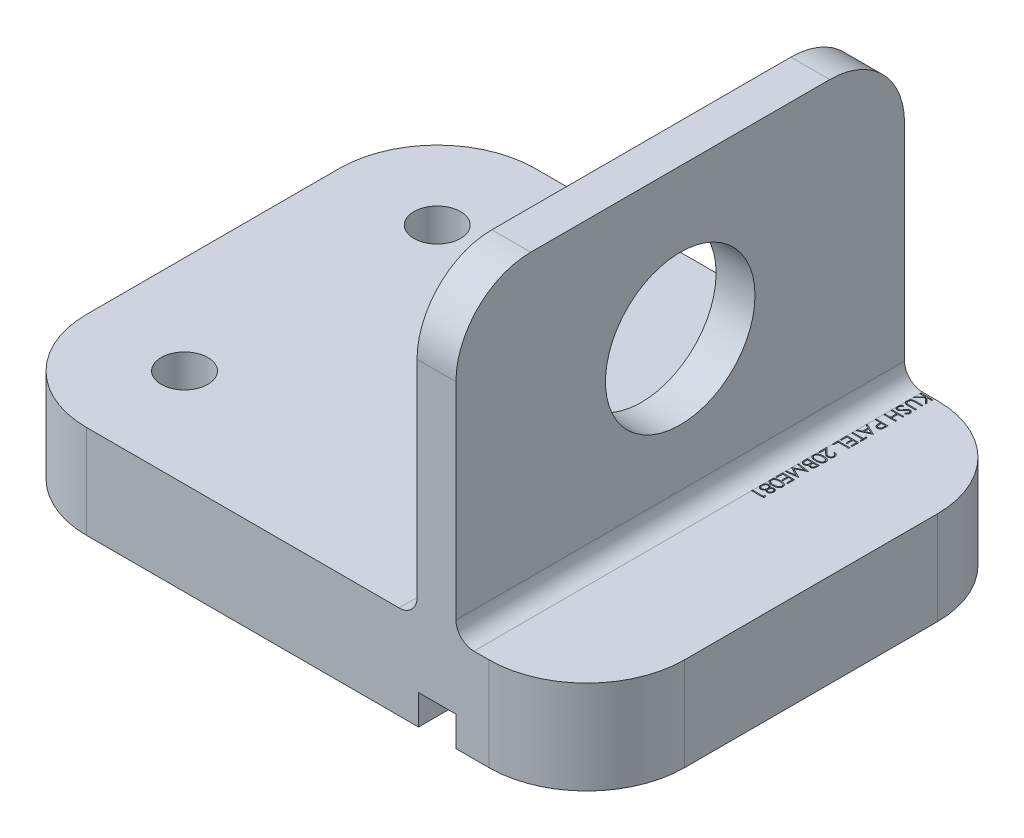
from build123d import *

# Parameters (mm, degrees)
SKETCH1_W             = 2865
SKETCH1_H             = 3000
SKETCH1_R             = 156
BOSS_EXTRUDE2_DEPTH   = 625
SKETCH1_W_2           = 875
BOSS_EXTRUDE2_2_DEPTH = 625
SKETCH1_4_W           = 260
SKETCH1_4_H           = 3000
BOSS_EXTRUDE3_DEPTH   = 2625
SKETCH2_R             = 500
CUT_EXTRUDE1_DEPTH    = 1000
SKETCH3_W             = 250
SKETCH3_H             = 3000
CUT_EXTRUDE2_DEPTH    = 200
FILLET2_R             = 655
FILLET3_R             = 655
FILLET4_R             = 655
FILLET5_R             = 655
FILLET11_R            = 120
FILLET13_R            = 120
FILLET14_R            = 500
FILLET15_R            = 500
CUT_EXTRUDE4_DEPTH    = 30


with BuildPart() as part:
    # Sketch1 → Boss-Extrude2 (new body)
    with BuildSketch(Plane(origin=(0, 0, 0), x_dir=(1, 0, 0), z_dir=(0, 1, 0))):
        with Locations((1432.5, 1500)):
            Rectangle(SKETCH1_W, SKETCH1_H)
        with Locations((655, 655)):
            Circle(SKETCH1_R, mode=Mode.SUBTRACT)
        with Locations((655, 2345)):
            Circle(SKETCH1_R, mode=Mode.SUBTRACT)
    extrude(amount=BOSS_EXTRUDE2_DEPTH)



with BuildPart() as body_2:
    # Sketch1 → Boss-Extrude2 2 (new body)
    with BuildSketch(Plane(origin=(0, 0, 0), x_dir=(1, 0, 0), z_dir=(0, 1, 0))):
        with Locations((3562.5, 1500)):
            Rectangle(SKETCH1_W_2, SKETCH1_H)
    extrude(amount=BOSS_EXTRUDE2_2_DEPTH)


with BuildPart() as part_1:
    add(part.part)

    add(body_2.part)  # Boss-Extrude3 merges body 2
    # Sketch1<4> → Boss-Extrude3 (add)
    with BuildSketch(Plane(origin=(0, 0, 0), x_dir=(1, 0, 0), z_dir=(0, 1, 0))):
        with Locations((2995, 1500)):
            Rectangle(SKETCH1_4_W, SKETCH1_4_H)
    extrude(amount=BOSS_EXTRUDE3_DEPTH)

    # Sketch2 → Cut-Extrude1 (cut)
    with BuildSketch(Plane(origin=(3125, 0, 0), x_dir=(0, 0, -1), z_dir=(1, 0, 0))):
        with Locations((1500, 1625)):
            Circle(SKETCH2_R)
    extrude(amount=-CUT_EXTRUDE1_DEPTH, mode=Mode.SUBTRACT)

    # Sketch3 → Cut-Extrude2 (cut)
    with BuildSketch(Plane.XZ):
        with Locations((3000, -1500)):
            Rectangle(SKETCH3_W, SKETCH3_H)
    extrude(amount=-CUT_EXTRUDE2_DEPTH, mode=Mode.SUBTRACT)

    # Fillet2
    fillet2_edges = [part_1.edges().sort_by_distance(p)[0] for p in [
        (0, 312.5, 0),
    ]]
    fillet(fillet2_edges, radius=FILLET2_R)

    # Fillet3
    fillet3_edges = [part_1.edges().sort_by_distance(p)[0] for p in [
        (0, 312.5, -3000),
    ]]
    fillet(fillet3_edges, radius=FILLET3_R)

    # Fillet4
    fillet4_edges = [part_1.edges().sort_by_distance(p)[0] for p in [
        (4000, 312.5, 0),
    ]]
    fillet(fillet4_edges, radius=FILLET4_R)

    # Fillet5
    fillet5_edges = [part_1.edges().sort_by_distance(p)[0] for p in [
        (4000, 312.5, -3000),
    ]]
    fillet(fillet5_edges, radius=FILLET5_R)

    # Fillet11
    fillet11_edges = [part_1.edges().sort_by_distance(p)[0] for p in [
        (2865, 625, -1500),
    ]]
    fillet(fillet11_edges, radius=FILLET11_R)

    # Fillet13
    fillet13_edges = [part_1.edges().sort_by_distance(p)[0] for p in [
        (3125, 625, -1500),
    ]]
    fillet(fillet13_edges, radius=FILLET13_R)

    # Fillet14
    fillet14_edges = [part_1.edges().sort_by_distance(p)[0] for p in [
        (2995, 2625, 0),
    ]]
    fillet(fillet14_edges, radius=FILLET14_R)

    # Fillet15
    fillet15_edges = [part_1.edges().sort_by_distance(p)[0] for p in [
        (2995, 2625, -3000),
    ]]
    fillet(fillet15_edges, radius=FILLET15_R)

    # Sketch6 → Cut-Extrude4 (cut)
    # profile 1 of 17: a face of its own
    with BuildSketch(Plane(origin=(0, 625, 0), x_dir=(1, 0, 0), z_dir=(0, 1, 0))):
        Polygon((3325, 2989.743589744), (3325, 2982.564102564), (3294.53525641, 2982.564102564), (3325, 2949.21474359), (3325, 2938.974358974), (3289.102564103, 2978.28525641), (3245, 2935.897435897), (3245, 2945.46474359), (3283.605769231, 2982.564102564), (3245, 2982.564102564), (3245, 2989.743589744), align=None)
    # profile 2 of 17: a face of its own
    with BuildSketch(Plane(origin=(0, 625, 0), x_dir=(1, 0, 0), z_dir=(0, 1, 0))):
        with BuildLine():
            Line((3325, 2924.102564103), (3325, 2916.923076923))
            Line((3325, 2916.923076923), (3277.067307692, 2916.923076923))
            add(Edge.make_bspline(
                [(3277.067307692, 2916.923076923), (3276.388890875, 2916.924145357), (3275.101478054, 2916.926172894), (3273.269059756, 2916.91262972), (3271.639974977, 2916.874701299), (3270.207944176, 2916.85078908), (3268.97953852, 2916.797592885), (3267.948102847, 2916.754208956), (3267.118521077, 2916.698424803), (3266.634385624, 2916.631382117), (3266.426282051, 2916.602564103)],
                knots=[0, 0, 0, 0, 1.528628734, 2.90083645, 4.128790002, 5.200304208, 6.127813768, 6.898992206, 7.526736466, 8, 8, 8, 8], degree=3))
            add(Edge.make_bspline(
                [(3266.426282051, 2916.602564103), (3265.675433864, 2916.484337058), (3264.216045098, 2916.25454464), (3262.139031094, 2915.66677021), (3260.260720003, 2914.852502388), (3258.543651238, 2913.861085985), (3257.013352204, 2912.586100863), (3255.592614054, 2911.068615057), (3254.365196827, 2909.212926434), (3253.235979056, 2907.150858915), (3252.329682801, 2904.926908733), (3251.644033478, 2902.654725838), (3251.226252101, 2900.368010199), (3251.177871178, 2898.837128912), (3251.153846154, 2898.076923077)],
                knots=[0, 0, 0, 0, 1.035924841, 2.013479024, 2.933602255, 3.82183108, 4.706948133, 5.639927629, 6.646101806, 7.731477349, 8.84205456, 9.913728764, 10.963998332, 12, 12, 12, 12], degree=3))
            add(Edge.make_bspline(
                [(3251.153846154, 2898.076923077), (3251.178389947, 2897.42426497), (3251.227335774, 2896.122718337), (3251.530474401, 2894.188874696), (3252.076695914, 2892.305376328), (3252.781897361, 2890.463330502), (3253.712186697, 2888.735504682), (3254.794267001, 2887.123135394), (3256.044994929, 2885.668703517), (3257.448883154, 2884.357078009), (3259.018429196, 2883.208688394), (3260.748904045, 2882.239744581), (3262.634619106, 2881.42311066), (3263.964319406, 2881.022907129), (3264.647435897, 2880.817307692)],
                knots=[0, 0, 0, 0, 0.994510594, 1.983277156, 2.972612928, 3.9776239, 4.982470102, 5.955333794, 6.930747147, 7.898149105, 8.876444039, 9.885893618, 10.913904934, 12, 12, 12, 12], degree=3))
            add(Edge.make_bspline(
                [(3264.647435897, 2880.817307692), (3264.929689025, 2880.7487334), (3265.558662741, 2880.595922241), (3266.622006526, 2880.453132641), (3267.876620559, 2880.30441206), (3269.331519138, 2880.201221889), (3270.981827083, 2880.100622565), (3272.83614154, 2880.040438044), (3274.887729215, 2880.012620149), (3276.31943577, 2880.004330312), (3277.067307692, 2880)],
                knots=[0, 0, 0, 0, 0.558680831, 1.244966039, 2.062412453, 2.990489873, 4.051219941, 5.244515665, 6.560634259, 8, 8, 8, 8], degree=3))
            Line((3277.067307692, 2880), (3325, 2880))
            Line((3325, 2880), (3325, 2872.820512821))
            Line((3325, 2872.820512821), (3276.682692308, 2872.820512821))
            add(Edge.make_bspline(
                [(3276.682692308, 2872.820512821), (3275.811862848, 2872.826257117), (3274.112386211, 2872.837467459), (3271.622199593, 2872.93665779), (3269.259385913, 2873.090240001), (3267.026959981, 2873.322422988), (3264.922263304, 2873.578744652), (3262.948370821, 2873.945489078), (3261.092047109, 2874.328879366), (3259.356470445, 2874.813823989), (3257.71867739, 2875.398827123), (3256.135469774, 2876.083754921), (3254.619789738, 2876.921861394), (3253.149746876, 2877.87825547), (3251.723327271, 2878.940114142), (3250.374029044, 2880.164035945), (3249.057615454, 2881.486654564), (3247.817526002, 2882.935830479), (3246.672171876, 2884.485665285), (3245.686938248, 2886.138912001), (3244.821846699, 2887.862280772), (3244.138507975, 2889.674230331), (3243.6096009, 2891.562958635), (3243.220362467, 2893.528368073), (3242.99830599, 2895.577142295), (3242.965387426, 2896.970636877), (3242.948717949, 2897.676282051)],
                knots=[0, 0, 0, 0, 1.316364231, 2.568964831, 3.766826305, 4.894964518, 5.961692026, 6.970710131, 7.928946231, 8.826316495, 9.692177228, 10.556379512, 11.43093279, 12.306715499, 13.20629939, 14.115652445, 15.057829886, 16.025681089, 16.996391533, 17.967202739, 18.931442607, 19.907779629, 20.889445314, 21.893507297, 22.933303057, 24, 24, 24, 24], degree=3))
            add(Edge.make_bspline(
                [(3242.948717949, 2897.676282051), (3242.96665544, 2898.445861539), (3243.001848735, 2899.955773742), (3243.203511595, 2902.180643852), (3243.583360608, 2904.313539767), (3244.067016465, 2906.376988385), (3244.734073317, 2908.342896891), (3245.513459028, 2910.237604191), (3246.470653549, 2912.028659759), (3247.535645389, 2913.745119842), (3248.733922833, 2915.341114268), (3250.039983952, 2916.806197768), (3251.432906864, 2918.142789096), (3252.927772367, 2919.328359298), (3254.512954241, 2920.382550946), (3256.192936865, 2921.290670109), (3257.967069806, 2922.070401403), (3259.200285815, 2922.472837222), (3259.823717949, 2922.676282051)],
                knots=[0, 0, 0, 0, 1.13879206, 2.234305948, 3.301075583, 4.341971843, 5.366689343, 6.369221514, 7.369726634, 8.367512178, 9.355451585, 10.318319045, 11.268648973, 12.207971039, 13.137398894, 14.081662264, 15.030215811, 16, 16, 16, 16], degree=3))
            add(Edge.make_bspline(
                [(3259.823717949, 2922.676282051), (3260.249605365, 2922.794617095), (3261.173364655, 2923.051288441), (3262.702198679, 2923.326152387), (3264.462539654, 2923.55721711), (3266.454508073, 2923.774487013), (3268.679647882, 2923.902691766), (3271.13699453, 2924.015090365), (3273.829519368, 2924.103355937), (3275.705051154, 2924.102835425), (3276.682692308, 2924.102564103)],
                knots=[0, 0, 0, 0, 0.625038921, 1.35572334, 2.194682327, 3.136881307, 4.189498639, 5.346923369, 6.617055217, 8, 8, 8, 8], degree=3))
            Line((3276.682692308, 2924.102564103), (3325, 2924.102564103))
        make_face()
    # profile 3 of 17: a face of its own
    with BuildSketch(Plane(origin=(0, 625, 0), x_dir=(1, 0, 0), z_dir=(0, 1, 0))):
        with BuildLine():
            Line((3260.432692308, 2859.487179487), (3264.487179487, 2852.724358974))
            add(Edge.make_bspline(
                [(3264.487179487, 2852.724358974), (3263.43427926, 2852.095370694), (3261.416963056, 2850.890253423), (3258.691064989, 2848.879936642), (3256.374215692, 2846.796898673), (3254.479893234, 2844.625713906), (3252.988490108, 2842.379635092), (3251.932439097, 2840.043999578), (3251.273788232, 2837.62667819), (3251.193786253, 2835.98156227), (3251.153846154, 2835.16025641)],
                knots=[0, 0, 0, 0, 1.272034388, 2.437168799, 3.508375237, 4.49857839, 5.41946034, 6.295179144, 7.148887113, 8, 8, 8, 8], degree=3))
            add(Edge.make_bspline(
                [(3251.153846154, 2835.16025641), (3251.173381501, 2834.458842383), (3251.212110373, 2833.068287427), (3251.584243349, 2831.021151505), (3252.1559478, 2829.032992023), (3252.974717012, 2827.144809569), (3253.965292683, 2825.382569985), (3255.161841015, 2823.837464252), (3256.501183347, 2822.500878294), (3257.996473536, 2821.41055269), (3259.599054404, 2820.564125855), (3261.258742646, 2819.95162798), (3262.968237831, 2819.561809921), (3264.127223966, 2819.512193902), (3264.711538462, 2819.487179487)],
                knots=[0, 0, 0, 0, 1.095270387, 2.171376115, 3.241375676, 4.322296363, 5.380636668, 6.392615365, 7.366724986, 8.328592944, 9.273498763, 10.190095884, 11.087518669, 12, 12, 12, 12], degree=3))
            add(Edge.make_bspline(
                [(3264.711538462, 2819.487179487), (3265.377615026, 2819.520878017), (3266.73165135, 2819.589382205), (3268.729357703, 2820.168387464), (3270.706330732, 2821.079227392), (3271.929216802, 2821.919516391), (3272.564102564, 2822.355769231)],
                knots=[0, 0, 0, 0, 0.938893495, 1.908633276, 2.914225137, 4, 4, 4, 4], degree=3))
            add(Edge.make_bspline(
                [(3272.564102564, 2822.355769231), (3273.023252373, 2822.712940684), (3273.990009449, 2823.464978521), (3275.404991625, 2824.775759953), (3276.900210881, 2826.273856447), (3278.469595473, 2827.966757388), (3280.084484534, 2829.888114129), (3281.778540586, 2831.99847395), (3283.54667235, 2834.308761307), (3284.715920625, 2835.936947435), (3285.320512821, 2836.778846154)],
                knots=[0, 0, 0, 0, 0.72226686, 1.520759855, 2.393439377, 3.351307446, 4.386958158, 5.510256019, 6.712608938, 8, 8, 8, 8], degree=3))
            add(Edge.make_bspline(
                [(3285.320512821, 2836.778846154), (3285.920160615, 2837.620425222), (3287.066641535, 2839.229460316), (3288.76599404, 2841.481393664), (3290.329586105, 2843.492417892), (3291.735637468, 2845.272780165), (3293.045472968, 2846.776420257), (3294.18889274, 2848.058307048), (3295.226954099, 2849.071146884), (3295.899821983, 2849.634768362), (3296.201923077, 2849.887820513)],
                knots=[0, 0, 0, 0, 1.452255772, 2.776602448, 3.96446981, 5.032613149, 5.964194703, 6.766668629, 7.446264616, 8, 8, 8, 8], degree=3))
            add(Edge.make_bspline(
                [(3296.201923077, 2849.887820513), (3296.672803919, 2850.24147869), (3297.598854291, 2850.936994957), (3299.046279612, 2851.855075082), (3300.52795425, 2852.635398803), (3302.047859725, 2853.247109252), (3303.5846581, 2853.762222826), (3305.158400859, 2854.108689813), (3306.762026423, 2854.325636029), (3307.841192152, 2854.347852864), (3308.381410256, 2854.358974359)],
                knots=[0, 0, 0, 0, 1.068054152, 2.10047183, 3.106115577, 4.101338837, 5.06977816, 6.043150881, 7.020423561, 8, 8, 8, 8], degree=3))
            add(Edge.make_bspline(
                [(3308.381410256, 2854.358974359), (3309.227875971, 2854.329271147), (3310.90271479, 2854.270499608), (3313.348105587, 2853.769399691), (3315.689925636, 2852.987716934), (3317.876591783, 2851.857174807), (3319.902990485, 2850.459406128), (3321.738161682, 2848.807463115), (3323.294068645, 2846.846144399), (3324.637729575, 2844.682199636), (3325.698606066, 2842.328880846), (3326.503122538, 2839.867304092), (3326.952896512, 2837.286675267), (3327.018164638, 2835.535826433), (3327.051282051, 2834.647435897)],
                knots=[0, 0, 0, 0, 1.005541892, 1.989591032, 2.955705311, 3.932863626, 4.905387107, 5.876519979, 6.856563935, 7.871847665, 8.897921447, 9.918317993, 10.943742853, 12, 12, 12, 12], degree=3))
            add(Edge.make_bspline(
                [(3327.051282051, 2834.647435897), (3327.019375685, 2833.70457308), (3326.956101547, 2831.834763368), (3326.386249751, 2829.07919658), (3325.465758682, 2826.421053235), (3324.405576235, 2824.28137809), (3323.351452994, 2822.609672349), (3322.390931411, 2821.334889124), (3321.285234977, 2820.043055115), (3320.031303345, 2818.723787229), (3318.617665092, 2817.399428727), (3317.053991683, 2816.050321415), (3315.349841985, 2814.673309508), (3314.133281946, 2813.787461283), (3313.509615385, 2813.333333333)],
                knots=[0, 0, 0, 0, 1.286821612, 2.551921131, 3.825787379, 5.12137259, 5.803616487, 6.523126609, 7.299589446, 8.125436757, 9.008162487, 9.944516264, 10.946261234, 12, 12, 12, 12], degree=3))
            Line((3313.509615385, 2813.333333333), (3308.58974359, 2819.823717949))
            add(Edge.make_bspline(
                [(3308.58974359, 2819.823717949), (3309.094627956, 2820.215624972), (3310.0669172, 2820.970346268), (3311.428547084, 2822.11616317), (3312.672352963, 2823.196132064), (3313.752696656, 2824.260141868), (3314.728752248, 2825.251994126), (3315.56438139, 2826.214676524), (3316.26789645, 2827.134295632), (3317.018302195, 2828.293636164), (3317.766887453, 2829.753877583), (3318.386843851, 2831.585094788), (3318.772809904, 2833.493553871), (3318.821437119, 2834.789832495), (3318.846153846, 2835.448717949)],
                knots=[0, 0, 0, 0, 1.181667846, 2.275615987, 3.290305621, 4.226321945, 5.078535498, 5.862783384, 6.581873284, 7.217493746, 8.414623899, 9.604724551, 10.782505457, 12, 12, 12, 12], degree=3))
            add(Edge.make_bspline(
                [(3318.846153846, 2835.448717949), (3318.818457847, 2836.275152747), (3318.765048722, 2837.868854402), (3318.181734773, 2840.13148837), (3317.263292252, 2842.167920943), (3315.976092752, 2843.917693858), (3314.451041491, 2845.374539048), (3312.696096232, 2846.428378105), (3310.758212744, 2847.062667581), (3309.406403456, 2847.140068259), (3308.717948718, 2847.179487179)],
                knots=[0, 0, 0, 0, 1.14458467, 2.207223713, 3.21896685, 4.227309161, 5.202851033, 6.127160689, 7.046193047, 8, 8, 8, 8], degree=3))
            add(Edge.make_bspline(
                [(3308.717948718, 2847.179487179), (3308.289452769, 2847.170083109), (3307.431760195, 2847.15125959), (3306.161254189, 2846.906439625), (3304.902026024, 2846.559292274), (3303.64847643, 2846.051220746), (3302.371114691, 2845.366871215), (3301.073389531, 2844.436361579), (3299.72253651, 2843.272255718), (3298.84481878, 2842.378779704), (3298.381410256, 2841.907051282)],
                knots=[0, 0, 0, 0, 0.858526328, 1.718456515, 2.587092892, 3.476767204, 4.426280253, 5.487868114, 6.673670035, 8, 8, 8, 8], degree=3))
            add(Edge.make_bspline(
                [(3298.381410256, 2841.907051282), (3298.225135381, 2841.731934198), (3297.853862047, 2841.315896092), (3297.24603849, 2840.555303504), (3296.496260837, 2839.550896687), (3295.568550746, 2838.328903518), (3294.492403041, 2836.866792392), (3293.28157762, 2835.164402538), (3291.896767128, 2833.240710359), (3290.928594772, 2831.875637995), (3290.416666667, 2831.153846154)],
                knots=[0, 0, 0, 0, 0.420754252, 0.999615792, 1.744751191, 2.668019286, 3.750313428, 4.999500688, 6.413464383, 8, 8, 8, 8], degree=3))
            add(Edge.make_bspline(
                [(3290.416666667, 2831.153846154), (3289.784864163, 2830.285596707), (3288.56146618, 2828.60435199), (3286.723393493, 2826.212178734), (3284.925730212, 2824.043177407), (3283.179956335, 2822.089732754), (3281.499314209, 2820.332546275), (3279.863584373, 2818.79111266), (3278.284485569, 2817.44972568), (3276.259969553, 2816.005629258), (3273.77354477, 2814.530021955), (3270.727185032, 2813.262787499), (3267.66898342, 2812.463739558), (3265.613512872, 2812.359247776), (3264.599358974, 2812.307692308)],
                knots=[0, 0, 0, 0, 1.163667725, 2.253281268, 3.268753668, 4.215851969, 5.092017293, 5.902905408, 6.650798638, 7.335211899, 8.59617414, 9.77448103, 10.901945474, 12, 12, 12, 12], degree=3))
            add(Edge.make_bspline(
                [(3264.599358974, 2812.307692308), (3263.882144855, 2812.322720952), (3262.46164443, 2812.352486395), (3260.375731879, 2812.694328801), (3258.350189219, 2813.195800982), (3256.408218591, 2813.94924775), (3254.523834825, 2814.876058451), (3252.714395751, 2816.020802693), (3251.004775509, 2817.400791141), (3249.359397071, 2818.934592409), (3247.873147305, 2820.639155404), (3246.543863347, 2822.436453962), (3245.431261025, 2824.338156333), (3244.535613285, 2826.335058067), (3243.824016522, 2828.416112713), (3243.312535637, 2830.583510347), (3242.997898744, 2832.843286521), (3242.965294562, 2834.379311066), (3242.948717949, 2835.16025641)],
                knots=[0, 0, 0, 0, 0.983610584, 1.948120116, 2.894308362, 3.843560551, 4.801159957, 5.773581695, 6.77566113, 7.813174769, 8.857584665, 9.875476876, 10.877851407, 11.875574773, 12.875048225, 13.892438445, 14.928473903, 16, 16, 16, 16], degree=3))
            add(Edge.make_bspline(
                [(3242.948717949, 2835.16025641), (3242.96053598, 2835.764466154), (3242.984023207, 2836.965276243), (3243.186746214, 2838.736652185), (3243.484041969, 2840.475500287), (3243.937310312, 2842.159987222), (3244.500197606, 2843.811087909), (3245.189371657, 2845.414084941), (3246.00979833, 2846.97287288), (3246.962836522, 2848.489271958), (3248.061179459, 2849.977571015), (3249.330474728, 2851.430139969), (3250.761955052, 2852.863596338), (3252.370300604, 2854.251662655), (3254.138327848, 2855.619924606), (3256.080851122, 2856.942936895), (3258.187786669, 2858.247639942), (3259.670413721, 2859.066282307), (3260.432692308, 2859.487179487)],
                knots=[0, 0, 0, 0, 0.915384692, 1.819241058, 2.699029451, 3.586605375, 4.459625921, 5.340865773, 6.228072412, 7.126546901, 8.052715223, 9.028303326, 10.047266019, 11.120332924, 12.245748783, 13.433636234, 14.680528497, 16, 16, 16, 16], degree=3))
        make_face()
    # profile 4 of 17: a face of its own
    with BuildSketch(Plane(origin=(0, 625, 0), x_dir=(1, 0, 0), z_dir=(0, 1, 0))):
        Polygon((3325, 2795.897435897), (3325, 2788.717948718), (3292.179487179, 2788.717948718), (3292.179487179, 2747.692307692), (3325, 2747.692307692), (3325, 2740.512820513), (3245, 2740.512820513), (3245, 2747.692307692), (3283.974358974, 2747.692307692), (3283.974358974, 2788.717948718), (3245, 2788.717948718), (3245, 2795.897435897), align=None)
    # profile 5 of 17: a face of its own
    with BuildSketch(Plane(origin=(0, 625, 0), x_dir=(1, 0, 0), z_dir=(0, 1, 0))):
        with BuildLine():
            Line((3325, 2689.230769231), (3325, 2673.541666667))
            add(Edge.make_bspline(
                [(3325, 2673.541666667), (3324.9988138, 2672.46256024), (3324.996540989, 2670.394944405), (3324.927632513, 2667.430028846), (3324.835593836, 2664.73723498), (3324.708007706, 2662.32236913), (3324.557228501, 2660.178001174), (3324.345753315, 2658.313834327), (3324.124946559, 2656.715215897), (3323.900457267, 2655.757354195), (3323.798076923, 2655.320512821)],
                knots=[0, 0, 0, 0, 1.415646017, 2.712440637, 3.8905458, 4.950247383, 5.884950622, 6.709939814, 7.411656543, 8, 8, 8, 8], degree=3))
            add(Edge.make_bspline(
                [(3323.798076923, 2655.320512821), (3323.64671942, 2654.767516457), (3323.347570964, 2653.674554398), (3322.748380604, 2652.099692301), (3322.038003643, 2650.601248574), (3321.228045464, 2649.174500729), (3320.28536668, 2647.835437698), (3319.239786922, 2646.566918595), (3318.091881423, 2645.361667553), (3316.819397199, 2644.260626584), (3315.469250363, 2643.246977014), (3314.011372409, 2642.377419452), (3312.477493497, 2641.641888553), (3310.851904831, 2641.041183828), (3309.144486309, 2640.58441652), (3307.350253444, 2640.24694241), (3305.475371367, 2640.031022287), (3304.193975661, 2640.010464947), (3303.541666667, 2640)],
                knots=[0, 0, 0, 0, 0.999487232, 1.975422798, 2.933948774, 3.889618007, 4.832992075, 5.786114792, 6.754729845, 7.731954186, 8.717668599, 9.695514499, 10.68728626, 11.680675814, 12.71351902, 13.766008651, 14.862761406, 16, 16, 16, 16], degree=3))
            add(Edge.make_bspline(
                [(3303.541666667, 2640), (3302.883888912, 2640.009632565), (3301.596902307, 2640.02847933), (3299.71409572, 2640.254680137), (3297.914818231, 2640.559370231), (3296.203059363, 2641.027874285), (3294.58898461, 2641.64148967), (3293.047927878, 2642.36130802), (3291.606106806, 2643.229503), (3290.258286976, 2644.227099108), (3289.003203266, 2645.336849837), (3287.849950821, 2646.554059852), (3286.805280228, 2647.873815109), (3285.866849515, 2649.291921351), (3285.05642027, 2650.82220361), (3284.330539014, 2652.441452834), (3283.720914771, 2654.163743495), (3283.400227653, 2655.355572386), (3283.237179487, 2655.961538462)],
                knots=[0, 0, 0, 0, 1.121902311, 2.195077645, 3.232258892, 4.234102512, 5.217864754, 6.176164875, 7.132989551, 8.084763148, 9.034132444, 9.988522005, 10.94243251, 11.903244335, 12.886203696, 13.894208494, 14.929344452, 16, 16, 16, 16], degree=3))
            add(Edge.make_bspline(
                [(3283.237179487, 2655.961538462), (3283.130597063, 2656.462734667), (3282.897015482, 2657.561135292), (3282.636250754, 2659.370111799), (3282.413677024, 2661.476292049), (3282.246793879, 2663.876801304), (3282.103928315, 2666.569484845), (3281.990371883, 2669.555799299), (3281.927975224, 2672.841606777), (3281.924757103, 2675.133520927), (3281.923076923, 2676.330128205)],
                knots=[0, 0, 0, 0, 0.601384939, 1.31797006, 2.144135048, 3.087295005, 4.142315834, 5.309527816, 6.595305764, 8, 8, 8, 8], degree=3))
            Line((3281.923076923, 2676.330128205), (3281.923076923, 2682.051282051))
            Line((3281.923076923, 2682.051282051), (3245, 2682.051282051))
            Line((3245, 2682.051282051), (3245, 2689.230769231))
            Line((3245, 2689.230769231), (3325, 2689.230769231))
        make_face()
        with BuildLine():
            Line((3316.794871795, 2682.051282051), (3290.128205128, 2682.051282051))
            Line((3290.128205128, 2682.051282051), (3289.951923077, 2668.044871795))
            add(Edge.make_bspline(
                [(3289.951923077, 2668.044871795), (3289.951495407, 2667.360981088), (3289.9506698, 2666.040744179), (3290.043010491, 2664.128393786), (3290.144868457, 2662.358725254), (3290.304382415, 2660.727895501), (3290.514557038, 2659.248367412), (3290.743328098, 2657.90113696), (3291.053267361, 2656.70592689), (3291.485428374, 2655.305359539), (3292.208122205, 2653.749997336), (3293.284160553, 2652.069162343), (3294.618104869, 2650.621620814), (3296.138529642, 2649.377350195), (3297.836089656, 2648.413043762), (3299.638128833, 2647.687762378), (3301.545781079, 2647.265290137), (3302.850553572, 2647.208282609), (3303.509615385, 2647.179487179)],
                knots=[0, 0, 0, 0, 1.160368111, 2.240066715, 3.248291599, 4.168343349, 5.019594299, 5.784185847, 6.485545725, 7.113397927, 8.269509094, 9.383373363, 10.487084095, 11.595623793, 12.704274681, 13.786671823, 14.88201193, 16, 16, 16, 16], degree=3))
            add(Edge.make_bspline(
                [(3303.509615385, 2647.179487179), (3304.152731426, 2647.208436375), (3305.431166521, 2647.265983792), (3307.305704164, 2647.691094799), (3309.088624383, 2648.41162794), (3310.765285308, 2649.383884482), (3312.279487729, 2650.592428129), (3313.583326975, 2652.007890779), (3314.645727005, 2653.601369634), (3315.326714187, 2655.08441389), (3315.743197437, 2656.400895513), (3316.03447557, 2657.544511508), (3316.267071147, 2658.835717953), (3316.455399462, 2660.274984255), (3316.616622413, 2661.851139603), (3316.726015881, 2663.577729916), (3316.790049255, 2665.448213114), (3316.793225363, 2666.746740459), (3316.794871795, 2667.419871795)],
                knots=[0, 0, 0, 0, 1.120550889, 2.227516482, 3.330715807, 4.461473166, 5.594337325, 6.694900473, 7.802844763, 8.919519911, 9.52614448, 10.208195984, 10.975273469, 11.811520316, 12.738076669, 13.736566072, 14.826679847, 16, 16, 16, 16], degree=3))
            Line((3316.794871795, 2667.419871795), (3316.794871795, 2682.051282051))
        make_face(mode=Mode.SUBTRACT)
    # profile 6 of 17: a face of its own
    with BuildSketch(Plane(origin=(0, 625, 0), x_dir=(1, 0, 0), z_dir=(0, 1, 0))):
        Polygon((3325, 2590.769230769), (3245, 2553.846153846), (3245, 2561.650641026), (3270.641025641, 2573.477564103), (3270.641025641, 2609.743589744), (3245, 2621.907051282), (3245, 2629.743589744), (3325, 2591.794871795), align=None)
        Polygon((3309.407051282, 2591.362179487), (3278.846153846, 2605.849358974), (3278.846153846, 2577.259615385), align=None, mode=Mode.SUBTRACT)
    # profile 7 of 17: a face of its own
    with BuildSketch(Plane(origin=(0, 625, 0), x_dir=(1, 0, 0), z_dir=(0, 1, 0))):
        Polygon((3316.794871795, 2550.769230769), (3325, 2550.769230769), (3325, 2508.717948718), (3316.794871795, 2508.717948718), (3316.794871795, 2526.153846154), (3245, 2526.153846154), (3245, 2533.333333333), (3316.794871795, 2533.333333333), align=None)
    # profile 8 of 17: a face of its own
    with BuildSketch(Plane(origin=(0, 625, 0), x_dir=(1, 0, 0), z_dir=(0, 1, 0))):
        Polygon((3325, 2494.358974359), (3325, 2449.230769231), (3316.794871795, 2449.230769231), (3316.794871795, 2487.179487179), (3292.179487179, 2487.179487179), (3292.179487179, 2449.230769231), (3283.974358974, 2449.230769231), (3283.974358974, 2487.179487179), (3253.205128205, 2487.179487179), (3253.205128205, 2449.230769231), (3245, 2449.230769231), (3245, 2494.358974359), align=None)
    # profile 9 of 17: a face of its own
    with BuildSketch(Plane(origin=(0, 625, 0), x_dir=(1, 0, 0), z_dir=(0, 1, 0))):
        Polygon((3325, 2434.871794872), (3325, 2427.692307692), (3253.205128205, 2427.692307692), (3253.205128205, 2396.923076923), (3245, 2396.923076923), (3245, 2434.871794872), align=None)
    # profile 10 of 17: a face of its own
    with BuildSketch(Plane(origin=(0, 625, 0), x_dir=(1, 0, 0), z_dir=(0, 1, 0))):
        with BuildLine():
            Line((3300.384615385, 2349.743589744), (3300.384615385, 2356.923076923))
            add(Edge.make_bspline(
                [(3300.384615385, 2356.923076923), (3301.337097514, 2356.876292819), (3303.207747069, 2356.784410083), (3305.935084208, 2356.353936487), (3308.542291481, 2355.738552891), (3311.007016876, 2354.86641077), (3313.358703607, 2353.789391464), (3315.566123993, 2352.470808155), (3317.651186421, 2350.938770906), (3319.574413743, 2349.196090299), (3321.332483975, 2347.305121227), (3322.866733452, 2345.277193537), (3324.148192912, 2343.133150492), (3325.225289142, 2340.891588603), (3326.032798979, 2338.526583545), (3326.6322212, 2336.060742119), (3326.992804169, 2333.482918976), (3327.031567636, 2331.72657759), (3327.051282051, 2330.833333333)],
                knots=[0, 0, 0, 0, 1.100776268, 2.161895295, 3.184016182, 4.190939212, 5.176500551, 6.166955529, 7.155448256, 8.160289653, 9.16017456, 10.133824356, 11.091467644, 12.04088621, 13.000931625, 13.972173743, 14.968683325, 16, 16, 16, 16], degree=3))
            add(Edge.make_bspline(
                [(3327.051282051, 2330.833333333), (3327.030745904, 2329.956120211), (3326.990393108, 2328.232427762), (3326.643855296, 2325.716724575), (3326.101098916, 2323.321814987), (3325.339603686, 2321.052380323), (3324.315959631, 2318.926527419), (3323.086301605, 2316.928286401), (3321.664134031, 2315.033867868), (3319.989761152, 2313.328569957), (3318.202278078, 2311.762671003), (3316.293983138, 2310.411762314), (3314.323028036, 2309.254890006), (3312.274383429, 2308.29060018), (3310.128759922, 2307.580745576), (3307.917395287, 2307.041815107), (3305.617399607, 2306.737188508), (3304.060678335, 2306.690435971), (3303.269230769, 2306.666666667)],
                knots=[0, 0, 0, 0, 1.111607364, 2.184268762, 3.212621178, 4.221274766, 5.211760367, 6.196651075, 7.1921475, 8.207485113, 9.220403448, 10.201281604, 11.166441695, 12.114753415, 13.065576456, 14.026450734, 14.996634279, 16, 16, 16, 16], degree=3))
            add(Edge.make_bspline(
                [(3303.269230769, 2306.666666667), (3302.15499455, 2306.705369818), (3299.946075381, 2306.782096934), (3296.700021375, 2307.438425541), (3293.555028939, 2308.463488652), (3291.023890605, 2309.697713952), (3288.984267891, 2310.942798387), (3287.304983207, 2312.064798561), (3285.496858215, 2313.378279956), (3283.565947647, 2314.902359909), (3281.497126959, 2316.605511273), (3279.291645921, 2318.503160721), (3276.972291182, 2320.60884031), (3275.388163151, 2322.086748898), (3274.567307692, 2322.852564103)],
                knots=[0, 0, 0, 0, 1.184426356, 2.348067706, 3.509069118, 4.696110526, 5.333549288, 6.050745305, 6.844228056, 7.710549037, 8.667450064, 9.695053472, 10.805634456, 12, 12, 12, 12], degree=3))
            Line((3274.567307692, 2322.852564103), (3253.205128205, 2342.868589744))
            Line((3253.205128205, 2342.868589744), (3253.205128205, 2305.641025641))
            Line((3253.205128205, 2305.641025641), (3245, 2305.641025641))
            Line((3245, 2305.641025641), (3245, 2360))
            Line((3245, 2360), (3278.108974359, 2328.974358974))
            add(Edge.make_bspline(
                [(3278.108974359, 2328.974358974), (3278.897464072, 2328.218925224), (3280.411991442, 2326.767891594), (3282.623824937, 2324.716422022), (3284.673364043, 2322.870908661), (3286.569690754, 2321.230127301), (3288.302054672, 2319.792727896), (3289.884031923, 2318.563309493), (3291.302046441, 2317.536438284), (3292.967870605, 2316.448168788), (3295.004157013, 2315.410431608), (3297.480088315, 2314.498366811), (3300.034501874, 2313.946215192), (3301.760176165, 2313.879641157), (3302.628205128, 2313.846153846)],
                knots=[0, 0, 0, 0, 1.329530082, 2.553755191, 3.672934919, 4.687409497, 5.60679272, 6.413407421, 7.126401618, 7.737995624, 8.834647426, 9.90044882, 10.943907757, 12, 12, 12, 12], degree=3))
            add(Edge.make_bspline(
                [(3302.628205128, 2313.846153846), (3303.174125983, 2313.860535834), (3304.250031157, 2313.888879971), (3305.826440164, 2314.143769021), (3307.352966579, 2314.518251626), (3308.810735997, 2315.095445003), (3310.228419925, 2315.788921593), (3311.562916349, 2316.674889074), (3312.859715051, 2317.687317252), (3314.074349877, 2318.861684278), (3315.18714399, 2320.150921064), (3316.172816255, 2321.513119581), (3316.99657287, 2322.954253274), (3317.671851329, 2324.468316303), (3318.201574729, 2326.051069049), (3318.568627865, 2327.705577736), (3318.79908467, 2329.427269475), (3318.830265738, 2330.602892242), (3318.846153846, 2331.201923077)],
                knots=[0, 0, 0, 0, 0.991504627, 1.954065223, 2.895985987, 3.842598665, 4.797835564, 5.759220273, 6.74786863, 7.784730864, 8.824135544, 9.839918996, 10.835834653, 11.835434876, 12.84861661, 13.863796685, 14.911511676, 16, 16, 16, 16], degree=3))
            add(Edge.make_bspline(
                [(3318.846153846, 2331.201923077), (3318.829815195, 2331.827544888), (3318.797728781, 2333.056162827), (3318.57314062, 2334.859987042), (3318.186062379, 2336.580948207), (3317.655386312, 2338.222530048), (3316.987260938, 2339.786314206), (3316.13902547, 2341.258160949), (3315.14379815, 2342.651507751), (3314.009293332, 2343.963795536), (3312.740215235, 2345.169582113), (3311.342940558, 2346.251270647), (3309.808380204, 2347.173836623), (3308.171195253, 2347.991649838), (3306.387855006, 2348.617397984), (3304.501573891, 2349.152281477), (3302.48555237, 2349.540834785), (3301.09655919, 2349.674882239), (3300.384615385, 2349.743589744)],
                knots=[0, 0, 0, 0, 1.031212865, 2.025131798, 2.990757446, 3.934781266, 4.865570067, 5.788494791, 6.729227313, 7.684356718, 8.643577152, 9.610526866, 10.590658432, 11.59095419, 12.621640561, 13.700587263, 14.82141059, 16, 16, 16, 16], degree=3))
        make_face()
    # profile 11 of 17: a face of its own
    with BuildSketch(Plane(origin=(0, 625, 0), x_dir=(1, 0, 0), z_dir=(0, 1, 0))):
        with BuildLine():
            add(Edge.make_bspline(
                [(3284.967948718, 2298.461538462), (3286.250174724, 2298.454040904), (3288.740917221, 2298.43947679), (3292.370280464, 2298.277455735), (3295.775087085, 2298.008305071), (3298.95549997, 2297.639450776), (3301.912340481, 2297.190582853), (3304.637705755, 2296.591371071), (3307.144213071, 2295.909937793), (3309.440024526, 2295.120160172), (3311.556109713, 2294.229036299), (3313.531460352, 2293.259020095), (3315.363568598, 2292.172144788), (3317.079957599, 2291.028671387), (3318.661471639, 2289.786814335), (3320.105115712, 2288.459672173), (3321.41176152, 2287.034080173), (3322.596960364, 2285.538233306), (3323.629419645, 2283.962678239), (3324.559734087, 2282.355984074), (3325.323300036, 2280.689799397), (3325.950706201, 2278.979320335), (3326.453430864, 2277.229521145), (3326.801566719, 2275.433171791), (3327.019754313, 2273.589838301), (3327.040673098, 2272.345705187), (3327.051282051, 2271.71474359)],
                knots=[0, 0, 0, 0, 1.646377244, 3.198111528, 4.663803227, 6.031090796, 7.308794487, 8.502186765, 9.612154809, 10.642545331, 11.617106989, 12.558866172, 13.465886467, 14.35053239, 15.20542558, 16.045215227, 16.865619885, 17.686225247, 18.492864914, 19.282407821, 20.068097601, 20.842842034, 21.620163247, 22.403093475, 23.190129512, 24, 24, 24, 24], degree=3))
            add(Edge.make_bspline(
                [(3327.051282051, 2271.71474359), (3327.04013199, 2271.078504082), (3327.017958027, 2269.813223878), (3326.80483934, 2267.94258673), (3326.451213669, 2266.115165433), (3325.950162822, 2264.338750834), (3325.328547355, 2262.598751144), (3324.54941325, 2260.908776112), (3323.642467711, 2259.258328531), (3322.576779086, 2257.673636245), (3321.388612773, 2256.13730218), (3320.045466058, 2254.687063027), (3318.560901046, 2253.322786778), (3316.9508013, 2252.027351226), (3315.184285075, 2250.837509004), (3313.292076851, 2249.704401982), (3311.241085656, 2248.690184018), (3309.065532105, 2247.713391443), (3306.705219904, 2246.870260317), (3304.173453949, 2246.109888997), (3301.440329678, 2245.495512572), (3298.520186928, 2244.983757776), (3295.402301597, 2244.587303011), (3292.093357243, 2244.298556907), (3288.591176885, 2244.146029249), (3286.196711761, 2244.11730465), (3284.967948718, 2244.102564103)],
                knots=[0, 0, 0, 0, 0.810914788, 1.612654377, 2.396697861, 3.181598691, 3.963628158, 4.749916497, 5.551656086, 6.361998678, 7.18212741, 8.025565596, 8.878627764, 9.750805457, 10.657531673, 11.591944965, 12.560506719, 13.57287815, 14.630710178, 15.753379473, 16.941251878, 18.199788006, 19.531962791, 20.947069417, 22.433333509, 24, 24, 24, 24], degree=3))
            add(Edge.make_bspline(
                [(3284.967948718, 2244.102564103), (3283.744549682, 2244.117475871), (3281.360806553, 2244.146530844), (3277.874321062, 2244.296646973), (3274.583159246, 2244.593737721), (3271.478159764, 2244.961192097), (3268.577757996, 2245.484625793), (3265.85437463, 2246.079677656), (3263.331512025, 2246.819263243), (3260.983647917, 2247.650902457), (3258.818753171, 2248.606499602), (3256.785491826, 2249.629681374), (3254.89482757, 2250.755833153), (3253.128337026, 2251.952771326), (3251.504273528, 2253.237195833), (3250.018623274, 2254.607248988), (3248.672366179, 2256.063973616), (3247.467965788, 2257.603781168), (3246.414682526, 2259.213402896), (3245.473216704, 2260.858341483), (3244.709275575, 2262.571428437), (3244.064265265, 2264.314591774), (3243.56206173, 2266.104279381), (3243.218206359, 2267.938735816), (3242.976379096, 2269.811953301), (3242.957970257, 2271.07828396), (3242.948717949, 2271.71474359)],
                knots=[0, 0, 0, 0, 1.56130642, 3.042141888, 4.451772327, 5.777565838, 7.030558081, 8.211376819, 9.333164717, 10.383253789, 11.387583522, 12.350962576, 13.286244149, 14.193812918, 15.072134482, 15.925989337, 16.770211267, 17.600669898, 18.417446232, 19.22325363, 20.01647746, 20.807971184, 21.593601364, 22.38506573, 23.188331689, 24, 24, 24, 24], degree=3))
            add(Edge.make_bspline(
                [(3242.948717949, 2271.71474359), (3242.959428991, 2272.345679554), (3242.980549075, 2273.589762124), (3243.197262086, 2275.433465867), (3243.550647987, 2277.227013634), (3244.030544288, 2278.973990856), (3244.640464029, 2280.677972763), (3245.416259346, 2282.322267166), (3246.316061224, 2283.928589536), (3247.339754247, 2285.489610182), (3248.512879793, 2286.975576974), (3249.810321805, 2288.395003643), (3251.264622768, 2289.712050207), (3252.852504373, 2290.938342831), (3254.560493432, 2292.102027947), (3256.405414922, 2293.178252668), (3258.399273427, 2294.146376811), (3260.527040069, 2295.057471509), (3262.839724589, 2295.860599764), (3265.359600586, 2296.564667577), (3268.100607414, 2297.151606593), (3271.054607842, 2297.623625988), (3274.223812824, 2298.012758492), (3277.613802361, 2298.276181274), (3281.221651662, 2298.439605823), (3283.696395195, 2298.454094171), (3284.967948718, 2298.461538462)],
                knots=[0, 0, 0, 0, 0.810940842, 1.599017053, 2.38298203, 3.159479784, 3.926441347, 4.70693857, 5.494146311, 6.292334103, 7.104379492, 7.925868426, 8.762126819, 9.623561095, 10.503686106, 11.41783325, 12.366995289, 13.351843594, 14.392337808, 15.512229747, 16.713911458, 17.994391108, 19.357476964, 20.818259213, 22.365182633, 24, 24, 24, 24], degree=3))
        make_face()
        with BuildLine():
            add(Edge.make_bspline(
                [(3285, 2291.282051282), (3283.931458313, 2291.279321064), (3281.857628717, 2291.274022246), (3278.844068471, 2291.135594799), (3276.033318081, 2290.947018087), (3273.421808733, 2290.703788373), (3271.018379683, 2290.342578335), (3268.806501852, 2289.937851044), (3266.797877191, 2289.44532562), (3264.978734149, 2288.862574647), (3263.318160438, 2288.198850126), (3261.773072158, 2287.47405292), (3260.324736433, 2286.695846842), (3258.987863555, 2285.823395303), (3257.749145897, 2284.876487393), (3256.612143204, 2283.85356822), (3255.581816495, 2282.756436796), (3254.359233959, 2281.237647255), (3253.080913772, 2279.242436537), (3251.981460811, 2276.715651735), (3251.286053281, 2274.118134336), (3251.197864105, 2272.354595751), (3251.153846154, 2271.474358974)],
                knots=[0, 0, 0, 0, 1.459116078, 2.831857795, 4.118796693, 5.306371758, 6.412361096, 7.436813035, 8.376339383, 9.234574298, 10.043323891, 10.816788787, 11.564361537, 12.286735248, 12.994408768, 13.691741332, 14.372975427, 15.047457468, 16.352811911, 17.594285292, 18.799233213, 20, 20, 20, 20], degree=3))
            add(Edge.make_bspline(
                [(3251.153846154, 2271.474358974), (3251.190366858, 2270.588469337), (3251.263332865, 2268.818519092), (3251.967304005, 2266.232603775), (3253.029464907, 2263.722197601), (3254.285407888, 2261.754838966), (3255.48148399, 2260.258095115), (3256.50124738, 2259.18570677), (3257.643095775, 2258.201431377), (3258.875079682, 2257.267898237), (3260.220736463, 2256.411690793), (3261.673595326, 2255.633104789), (3263.237690821, 2254.922628274), (3264.329570573, 2254.51785008), (3264.887820513, 2254.310897436)],
                knots=[0, 0, 0, 0, 1.353760809, 2.704726607, 4.075137775, 5.516104923, 6.260822281, 7.007110065, 7.778089737, 8.566572457, 9.372053459, 10.217411131, 11.088608312, 12, 12, 12, 12], degree=3))
            add(Edge.make_bspline(
                [(3264.887820513, 2254.310897436), (3265.601643129, 2254.069714172), (3267.051009169, 2253.580008713), (3269.299321217, 2252.948882444), (3271.658241535, 2252.451844748), (3274.113672774, 2252.004682102), (3276.683723083, 2251.699469396), (3279.36044043, 2251.453805092), (3282.145842995, 2251.309103677), (3284.038299937, 2251.291166509), (3285, 2251.282051282)],
                knots=[0, 0, 0, 0, 0.884706709, 1.796334032, 2.740027952, 3.714592787, 4.726048262, 5.777819803, 6.87074269, 8, 8, 8, 8], degree=3))
            add(Edge.make_bspline(
                [(3285, 2251.282051282), (3285.961679393, 2251.292104403), (3287.843162576, 2251.311772888), (3290.595774178, 2251.440996617), (3293.214730561, 2251.64864841), (3295.702407571, 2251.929700556), (3298.054377427, 2252.315525718), (3300.274005753, 2252.778863336), (3302.360694176, 2253.322073529), (3304.319824073, 2253.945151815), (3306.144353817, 2254.647352417), (3307.838255766, 2255.423073536), (3309.410509983, 2256.250873073), (3310.856603495, 2257.150155979), (3312.183063635, 2258.110049329), (3313.363282427, 2259.155938196), (3314.433841827, 2260.246323348), (3315.655843367, 2261.773573469), (3316.901824997, 2263.772985733), (3318.048470931, 2266.260886266), (3318.706946192, 2268.849929557), (3318.799784753, 2270.600179937), (3318.846153846, 2271.474358974)],
                knots=[0, 0, 0, 0, 1.313668642, 2.570134578, 3.763346207, 4.902004944, 5.98888779, 7.017888835, 7.998425394, 8.933058446, 9.82474457, 10.667209444, 11.476765193, 12.250262638, 12.991704352, 13.7104269, 14.401925311, 15.076585796, 16.378385137, 17.609787933, 18.806186071, 20, 20, 20, 20], degree=3))
            add(Edge.make_bspline(
                [(3318.846153846, 2271.474358974), (3318.799780602, 2272.359209661), (3318.706949631, 2274.13052302), (3318.050197622, 2276.745913455), (3316.912500536, 2279.251536478), (3315.647797235, 2281.234907648), (3314.4554747, 2282.760230854), (3313.418626496, 2283.837321991), (3312.278184184, 2284.844290057), (3311.044710943, 2285.791986855), (3309.7071638, 2286.663598531), (3308.259038693, 2287.442123087), (3306.713806831, 2288.166504245), (3305.053610932, 2288.83165374), (3303.231725425, 2289.40900413), (3301.233238087, 2289.925048879), (3299.019294272, 2290.329530625), (3296.609145882, 2290.682498529), (3293.994426158, 2290.951616536), (3291.177195671, 2291.135110702), (3288.158424024, 2291.274272709), (3286.073894319, 2291.279406493), (3285, 2291.282051282)],
                knots=[0, 0, 0, 0, 1.207964612, 2.418129846, 3.655795183, 4.951004962, 5.620895151, 6.296795572, 6.989224116, 7.696855977, 8.419187164, 9.166715907, 9.940135271, 10.748837255, 11.607021648, 12.548275234, 13.5654991, 14.678641405, 15.874140913, 17.15372626, 18.533675393, 20, 20, 20, 20], degree=3))
        make_face(mode=Mode.SUBTRACT)
    # profile 12 of 17: a face of its own
    with BuildSketch(Plane(origin=(0, 625, 0), x_dir=(1, 0, 0), z_dir=(0, 1, 0))):
        with BuildLine():
            Line((3325, 2229.743589744), (3325, 2214.134615385))
            add(Edge.make_bspline(
                [(3325, 2214.134615385), (3324.995982848, 2213.370535883), (3324.988196608, 2211.889559647), (3324.867439324, 2209.735972405), (3324.702784013, 2207.718856733), (3324.441524752, 2205.837627651), (3324.126284132, 2204.093154454), (3323.744528335, 2202.480179888), (3323.286777166, 2201.003833093), (3322.558862166, 2199.241256261), (3321.477189747, 2197.231641155), (3319.878822544, 2195.055677894), (3317.923794815, 2193.195009565), (3315.718476977, 2191.590750886), (3313.29251648, 2190.315296723), (3310.703735022, 2189.392569927), (3307.985523778, 2188.808389919), (3306.119393998, 2188.748311423), (3305.176282051, 2188.717948718)],
                knots=[0, 0, 0, 0, 1.001505555, 1.941167018, 2.826882275, 3.653841531, 4.429895133, 5.150066043, 5.825578002, 6.45369114, 7.647487171, 8.808567382, 9.977351308, 11.170798116, 12.373658725, 13.556498008, 14.765093433, 16, 16, 16, 16], degree=3))
            add(Edge.make_bspline(
                [(3305.176282051, 2188.717948718), (3304.29264537, 2188.742453626), (3302.556215961, 2188.790608082), (3300.020586959, 2189.266760135), (3297.596940075, 2189.975682622), (3295.315153858, 2191.004828606), (3293.204554212, 2192.32862882), (3291.277684335, 2193.921669585), (3289.581240314, 2195.818392862), (3288.636789501, 2197.241745131), (3288.157051282, 2197.96474359)],
                knots=[0, 0, 0, 0, 1.044266239, 2.052081639, 3.041743201, 4.026043445, 5.00270663, 5.980942822, 6.97441044, 8, 8, 8, 8], degree=3))
            add(Edge.make_bspline(
                [(3288.157051282, 2197.96474359), (3287.808406276, 2197.055781613), (3287.141362015, 2195.316712184), (3285.95561871, 2192.92180213), (3284.68048113, 2190.850151783), (3283.280596712, 2189.099480868), (3281.75280074, 2187.624811541), (3280.127686489, 2186.300527881), (3278.325247307, 2185.191075084), (3276.396806403, 2184.237961613), (3274.355898528, 2183.487871304), (3272.21185754, 2182.957133191), (3269.9886577, 2182.631020453), (3268.4733211, 2182.586551724), (3267.708333333, 2182.564102564)],
                knots=[0, 0, 0, 0, 1.272302504, 2.434229863, 3.488457646, 4.447234501, 5.35599188, 6.26022912, 7.18267843, 8.11661068, 9.06895546, 10.019249207, 11.000057067, 12, 12, 12, 12], degree=3))
            add(Edge.make_bspline(
                [(3267.708333333, 2182.564102564), (3266.927380685, 2182.586437481), (3265.390834469, 2182.630382055), (3263.133511002, 2182.954395609), (3260.976601815, 2183.503543034), (3258.904770973, 2184.258101594), (3256.929745764, 2185.248490924), (3255.026790654, 2186.427786531), (3253.246599083, 2187.863138741), (3251.546836127, 2189.463041962), (3250.019444761, 2191.275104464), (3248.659642327, 2193.229894408), (3247.536214006, 2195.355528106), (3246.604302766, 2197.619042605), (3245.882076316, 2200.03547903), (3245.380673219, 2202.595877816), (3245.042040533, 2205.30079536), (3245.014251293, 2207.157031605), (3245, 2208.108974359)],
                knots=[0, 0, 0, 0, 0.978404568, 1.925038397, 2.85041836, 3.763147166, 4.682162379, 5.614488577, 6.562659439, 7.54271123, 8.535210642, 9.526693784, 10.520907202, 11.541451354, 12.589717429, 13.675358278, 14.807842563, 16, 16, 16, 16], degree=3))
            Line((3245, 2208.108974359), (3245, 2229.743589744))
            Line((3245, 2229.743589744), (3325, 2229.743589744))
        make_face()
        with BuildLine():
            Line((3316.794871795, 2222.564102564), (3291.153846154, 2222.564102564))
            Line((3291.153846154, 2222.564102564), (3291.153846154, 2217.740384615))
            add(Edge.make_bspline(
                [(3291.153846154, 2217.740384615), (3291.162911183, 2217.035262943), (3291.180426666, 2215.672824178), (3291.232181602, 2213.694554667), (3291.370751604, 2211.862844524), (3291.517312242, 2210.171382006), (3291.742985634, 2208.63150403), (3292.019146459, 2207.238055505), (3292.308658491, 2205.978518896), (3292.802400281, 2204.526656762), (3293.524700405, 2202.880264351), (3294.672009663, 2201.136302904), (3296.001417349, 2199.573896865), (3297.563670259, 2198.269307519), (3299.26930434, 2197.192793266), (3301.118471637, 2196.474374375), (3303.038981283, 2195.964809296), (3304.360889172, 2195.920123747), (3305.032051282, 2195.897435897)],
                knots=[0, 0, 0, 0, 1.156481963, 2.23455883, 3.244418989, 4.168404366, 5.01828131, 5.794834307, 6.498111525, 7.13526334, 8.307595709, 9.435046769, 10.546766856, 11.659452936, 12.760769924, 13.837671619, 14.902137667, 16, 16, 16, 16], degree=3))
            add(Edge.make_bspline(
                [(3305.032051282, 2195.897435897), (3305.476278042, 2195.908783045), (3306.347677341, 2195.931041714), (3307.613083799, 2196.133622064), (3308.81842809, 2196.427568123), (3309.935988124, 2196.886801543), (3310.997528159, 2197.442109673), (3311.955898094, 2198.164464768), (3312.863603145, 2198.980248598), (3313.687314634, 2199.9383073), (3314.425363353, 2201.034001898), (3315.074781489, 2202.277772348), (3315.587061087, 2203.684469913), (3316.046603157, 2205.222199308), (3316.365475272, 2206.915570532), (3316.632094827, 2208.748037037), (3316.767624925, 2210.735144194), (3316.785586926, 2212.109885386), (3316.794871795, 2212.820512821)],
                knots=[0, 0, 0, 0, 0.911752476, 1.788502045, 2.626783689, 3.45400582, 4.26402138, 5.080402872, 5.911472738, 6.767166405, 7.66795952, 8.620018292, 9.640966946, 10.73819047, 11.913090943, 13.176185384, 14.540321519, 16, 16, 16, 16], degree=3))
            Line((3316.794871795, 2212.820512821), (3316.794871795, 2222.564102564))
        make_face(mode=Mode.SUBTRACT)
        with BuildLine():
            Line((3282.948717949, 2222.564102564), (3253.205128205, 2222.564102564))
            Line((3253.205128205, 2222.564102564), (3253.205128205, 2212.33974359))
            add(Edge.make_bspline(
                [(3253.205128205, 2212.33974359), (3253.213868939, 2211.607878797), (3253.230715551, 2210.197305893), (3253.286313124, 2208.160754645), (3253.410120658, 2206.278277664), (3253.611959958, 2204.548791704), (3253.821688577, 2202.957072579), (3254.111963128, 2201.51893406), (3254.441970195, 2200.232171367), (3254.952671764, 2198.740327009), (3255.744701429, 2197.059335792), (3256.946691235, 2195.249077495), (3258.359820831, 2193.623539857), (3260.015956659, 2192.258982427), (3261.80308765, 2191.132184407), (3263.711866505, 2190.34189521), (3265.68406208, 2189.83375058), (3267.032217893, 2189.773703857), (3267.708333333, 2189.743589744)],
                knots=[0, 0, 0, 0, 1.159821618, 2.235403267, 3.228114831, 4.14795534, 4.994323282, 5.771256229, 6.471395042, 7.097801288, 8.267864287, 9.404187171, 10.531774336, 11.667624178, 12.792825787, 13.866573821, 14.930062559, 16, 16, 16, 16], degree=3))
            add(Edge.make_bspline(
                [(3267.708333333, 2189.743589744), (3268.131092947, 2189.749744975), (3268.969793025, 2189.761956152), (3270.201357313, 2189.953040521), (3271.399656523, 2190.219615681), (3272.546570618, 2190.605639426), (3273.660762344, 2191.092384088), (3274.722824227, 2191.703230171), (3275.758150555, 2192.408641668), (3277.065533083, 2193.51213834), (3278.57237253, 2195.115678696), (3280.04746031, 2197.394821358), (3281.23714004, 2199.986151273), (3281.74226871, 2201.86564208), (3282.003205128, 2202.836538462)],
                knots=[0, 0, 0, 0, 0.723503378, 1.435336582, 2.130201219, 2.824764462, 3.504949994, 4.209866579, 4.920640069, 5.648298893, 7.13757748, 8.670694625, 10.280166878, 12, 12, 12, 12], degree=3))
            add(Edge.make_bspline(
                [(3282.003205128, 2202.836538462), (3282.082183784, 2203.225774575), (3282.253425801, 2204.069718754), (3282.434071227, 2205.445899012), (3282.596116055, 2207.022272801), (3282.712833602, 2208.79210242), (3282.83812785, 2210.762426712), (3282.885120835, 2212.932612687), (3282.942478255, 2215.304194583), (3282.946584846, 2216.949736538), (3282.948717949, 2217.804487179)],
                knots=[0, 0, 0, 0, 0.634452549, 1.375623993, 2.216454381, 3.166361212, 4.209414599, 5.370755378, 6.634280627, 8, 8, 8, 8], degree=3))
            Line((3282.948717949, 2217.804487179), (3282.948717949, 2222.564102564))
        make_face(mode=Mode.SUBTRACT)
    # profile 13 of 17: a face of its own
    with BuildSketch(Plane(origin=(0, 625, 0), x_dir=(1, 0, 0), z_dir=(0, 1, 0))):
        Polygon((3245, 2170.256410256), (3325, 2159.695512821), (3325, 2158.669871795), (3259.358974359, 2125.641025641), (3325, 2092.692307692), (3325, 2091.650641026), (3245, 2081.025641026), (3245, 2088.237179487), (3302.564102564, 2095.897435897), (3245, 2124.775641026), (3245, 2126.394230769), (3302.692307692, 2155.384615385), (3245, 2163.028846154), align=None)
    # profile 14 of 17: a face of its own
    with BuildSketch(Plane(origin=(0, 625, 0), x_dir=(1, 0, 0), z_dir=(0, 1, 0))):
        Polygon((3325, 2064.615384615), (3325, 2019.487179487), (3316.794871795, 2019.487179487), (3316.794871795, 2057.435897436), (3292.179487179, 2057.435897436), (3292.179487179, 2019.487179487), (3283.974358974, 2019.487179487), (3283.974358974, 2057.435897436), (3253.205128205, 2057.435897436), (3253.205128205, 2019.487179487), (3245, 2019.487179487), (3245, 2064.615384615), align=None)
    # profile 15 of 17: a face of its own
    with BuildSketch(Plane(origin=(0, 625, 0), x_dir=(1, 0, 0), z_dir=(0, 1, 0))):
        with BuildLine():
            add(Edge.make_bspline(
                [(3284.967948718, 2012.307692308), (3286.250174724, 2012.30019475), (3288.740917221, 2012.285630637), (3292.370280464, 2012.123609582), (3295.775087085, 2011.854458917), (3298.95549997, 2011.485604623), (3301.912340481, 2011.036736699), (3304.637705755, 2010.437524917), (3307.144213071, 2009.756091639), (3309.440024526, 2008.966314019), (3311.556109713, 2008.075190145), (3313.531460352, 2007.105173941), (3315.363568598, 2006.018298634), (3317.079957599, 2004.874825233), (3318.661471639, 2003.632968181), (3320.105115712, 2002.305826019), (3321.41176152, 2000.88023402), (3322.596960364, 1999.384387152), (3323.629419645, 1997.808832085), (3324.559734087, 1996.20213792), (3325.323300036, 1994.535953244), (3325.950706201, 1992.825474181), (3326.453430864, 1991.075674992), (3326.801566719, 1989.279325637), (3327.019754313, 1987.435992147), (3327.040673098, 1986.191859034), (3327.051282051, 1985.560897436)],
                knots=[0, 0, 0, 0, 1.646377244, 3.198111528, 4.663803227, 6.031090796, 7.308794487, 8.502186765, 9.612154809, 10.642545331, 11.617106989, 12.558866172, 13.465886467, 14.35053239, 15.20542558, 16.045215227, 16.865619885, 17.686225247, 18.492864914, 19.282407821, 20.068097601, 20.842842034, 21.620163247, 22.403093475, 23.190129512, 24, 24, 24, 24], degree=3))
            add(Edge.make_bspline(
                [(3327.051282051, 1985.560897436), (3327.04013199, 1984.924657928), (3327.017958027, 1983.659377724), (3326.80483934, 1981.788740576), (3326.451213669, 1979.96131928), (3325.950162822, 1978.184904681), (3325.328547355, 1976.44490499), (3324.54941325, 1974.754929958), (3323.642467711, 1973.104482378), (3322.576779086, 1971.519790091), (3321.388612773, 1969.983456026), (3320.045466058, 1968.533216873), (3318.560901046, 1967.168940624), (3316.9508013, 1965.873505072), (3315.184285075, 1964.68366285), (3313.292076851, 1963.550555828), (3311.241085656, 1962.536337864), (3309.065532105, 1961.559545289), (3306.705219904, 1960.716414163), (3304.173453949, 1959.956042843), (3301.440329678, 1959.341666418), (3298.520186928, 1958.829911622), (3295.402301597, 1958.433456857), (3292.093357243, 1958.144710753), (3288.591176885, 1957.992183095), (3286.196711761, 1957.963458496), (3284.967948718, 1957.948717949)],
                knots=[0, 0, 0, 0, 0.810914788, 1.612654377, 2.396697861, 3.181598691, 3.963628158, 4.749916497, 5.551656086, 6.361998678, 7.18212741, 8.025565596, 8.878627764, 9.750805457, 10.657531673, 11.591944965, 12.560506719, 13.57287815, 14.630710178, 15.753379473, 16.941251878, 18.199788006, 19.531962791, 20.947069417, 22.433333509, 24, 24, 24, 24], degree=3))
            add(Edge.make_bspline(
                [(3284.967948718, 1957.948717949), (3283.744549682, 1957.963629717), (3281.360806553, 1957.99268469), (3277.874321062, 1958.142800819), (3274.583159246, 1958.439891567), (3271.478159764, 1958.807345944), (3268.577757996, 1959.330779639), (3265.85437463, 1959.925831503), (3263.331512025, 1960.665417089), (3260.983647917, 1961.497056304), (3258.818753171, 1962.452653449), (3256.785491826, 1963.47583522), (3254.89482757, 1964.601986999), (3253.128337026, 1965.798925172), (3251.504273528, 1967.083349679), (3250.018623274, 1968.453402834), (3248.672366179, 1969.910127463), (3247.467965788, 1971.449935014), (3246.414682526, 1973.059556742), (3245.473216704, 1974.704495329), (3244.709275575, 1976.417582283), (3244.064265265, 1978.16074562), (3243.56206173, 1979.950433227), (3243.218206359, 1981.784889662), (3242.976379096, 1983.658107148), (3242.957970257, 1984.924437807), (3242.948717949, 1985.560897436)],
                knots=[0, 0, 0, 0, 1.56130642, 3.042141888, 4.451772327, 5.777565838, 7.030558081, 8.211376819, 9.333164717, 10.383253789, 11.387583522, 12.350962576, 13.286244149, 14.193812918, 15.072134482, 15.925989337, 16.770211267, 17.600669898, 18.417446232, 19.22325363, 20.01647746, 20.807971184, 21.593601364, 22.38506573, 23.188331689, 24, 24, 24, 24], degree=3))
            add(Edge.make_bspline(
                [(3242.948717949, 1985.560897436), (3242.959428991, 1986.1918334), (3242.980549075, 1987.43591597), (3243.197262086, 1989.279619713), (3243.550647987, 1991.07316748), (3244.030544288, 1992.820144702), (3244.640464029, 1994.524126609), (3245.416259346, 1996.168421012), (3246.316061224, 1997.774743382), (3247.339754247, 1999.335764028), (3248.512879793, 2000.82173082), (3249.810321805, 2002.241157489), (3251.264622768, 2003.558204053), (3252.852504373, 2004.784496677), (3254.560493432, 2005.948181793), (3256.405414922, 2007.024406514), (3258.399273427, 2007.992530657), (3260.527040069, 2008.903625355), (3262.839724589, 2009.70675361), (3265.359600586, 2010.410821423), (3268.100607414, 2010.997760439), (3271.054607842, 2011.469779834), (3274.223812824, 2011.858912338), (3277.613802361, 2012.12233512), (3281.221651662, 2012.285759669), (3283.696395195, 2012.300248017), (3284.967948718, 2012.307692308)],
                knots=[0, 0, 0, 0, 0.810940842, 1.599017053, 2.38298203, 3.159479784, 3.926441347, 4.70693857, 5.494146311, 6.292334103, 7.104379492, 7.925868426, 8.762126819, 9.623561095, 10.503686106, 11.41783325, 12.366995289, 13.351843594, 14.392337808, 15.512229747, 16.713911458, 17.994391108, 19.357476964, 20.818259213, 22.365182633, 24, 24, 24, 24], degree=3))
        make_face()
        with BuildLine():
            add(Edge.make_bspline(
                [(3285, 2005.128205128), (3283.931458313, 2005.12547491), (3281.857628717, 2005.120176092), (3278.844068471, 2004.981748645), (3276.033318081, 2004.793171933), (3273.421808733, 2004.549942219), (3271.018379683, 2004.188732181), (3268.806501852, 2003.78400489), (3266.797877191, 2003.291479466), (3264.978734149, 2002.708728493), (3263.318160438, 2002.045003972), (3261.773072158, 2001.320206766), (3260.324736433, 2000.542000688), (3258.987863555, 1999.669549149), (3257.749145897, 1998.72264124), (3256.612143204, 1997.699722066), (3255.581816495, 1996.602590642), (3254.359233959, 1995.083801101), (3253.080913772, 1993.088590383), (3251.981460811, 1990.561805581), (3251.286053281, 1987.964288182), (3251.197864105, 1986.200749598), (3251.153846154, 1985.320512821)],
                knots=[0, 0, 0, 0, 1.459116078, 2.831857795, 4.118796693, 5.306371758, 6.412361096, 7.436813035, 8.376339383, 9.234574298, 10.043323891, 10.816788787, 11.564361537, 12.286735248, 12.994408768, 13.691741332, 14.372975427, 15.047457468, 16.352811911, 17.594285292, 18.799233213, 20, 20, 20, 20], degree=3))
            add(Edge.make_bspline(
                [(3251.153846154, 1985.320512821), (3251.190366858, 1984.434623183), (3251.263332865, 1982.664672938), (3251.967304005, 1980.078757621), (3253.029464907, 1977.568351448), (3254.285407888, 1975.600992813), (3255.48148399, 1974.104248961), (3256.50124738, 1973.031860616), (3257.643095775, 1972.047585223), (3258.875079682, 1971.114052084), (3260.220736463, 1970.25784464), (3261.673595326, 1969.479258635), (3263.237690821, 1968.76878212), (3264.329570573, 1968.364003927), (3264.887820513, 1968.157051282)],
                knots=[0, 0, 0, 0, 1.353760809, 2.704726607, 4.075137775, 5.516104923, 6.260822281, 7.007110065, 7.778089737, 8.566572457, 9.372053459, 10.217411131, 11.088608312, 12, 12, 12, 12], degree=3))
            add(Edge.make_bspline(
                [(3264.887820513, 1968.157051282), (3265.601643129, 1967.915868018), (3267.051009169, 1967.426162559), (3269.299321217, 1966.79503629), (3271.658241535, 1966.297998594), (3274.113672774, 1965.850835948), (3276.683723083, 1965.545623242), (3279.36044043, 1965.299958938), (3282.145842995, 1965.155257523), (3284.038299937, 1965.137320355), (3285, 1965.128205128)],
                knots=[0, 0, 0, 0, 0.884706709, 1.796334032, 2.740027952, 3.714592787, 4.726048262, 5.777819803, 6.87074269, 8, 8, 8, 8], degree=3))
            add(Edge.make_bspline(
                [(3285, 1965.128205128), (3285.961679393, 1965.138258249), (3287.843162576, 1965.157926734), (3290.595774178, 1965.287150463), (3293.214730561, 1965.494802256), (3295.702407571, 1965.775854402), (3298.054377427, 1966.161679564), (3300.274005753, 1966.625017182), (3302.360694176, 1967.168227376), (3304.319824073, 1967.791305661), (3306.144353817, 1968.493506263), (3307.838255766, 1969.269227382), (3309.410509983, 1970.097026919), (3310.856603495, 1970.996309825), (3312.183063635, 1971.956203176), (3313.363282427, 1973.002092042), (3314.433841827, 1974.092477194), (3315.655843367, 1975.619727315), (3316.901824997, 1977.619139579), (3318.048470931, 1980.107040112), (3318.706946192, 1982.696083403), (3318.799784753, 1984.446333783), (3318.846153846, 1985.320512821)],
                knots=[0, 0, 0, 0, 1.313668642, 2.570134578, 3.763346207, 4.902004944, 5.98888779, 7.017888835, 7.998425394, 8.933058446, 9.82474457, 10.667209444, 11.476765193, 12.250262638, 12.991704352, 13.7104269, 14.401925311, 15.076585796, 16.378385137, 17.609787933, 18.806186071, 20, 20, 20, 20], degree=3))
            add(Edge.make_bspline(
                [(3318.846153846, 1985.320512821), (3318.799780602, 1986.205363507), (3318.706949631, 1987.976676866), (3318.050197622, 1990.592067301), (3316.912500536, 1993.097690324), (3315.647797235, 1995.081061494), (3314.4554747, 1996.6063847), (3313.418626496, 1997.683475838), (3312.278184184, 1998.690443903), (3311.044710943, 1999.638140702), (3309.7071638, 2000.509752378), (3308.259038693, 2001.288276933), (3306.713806831, 2002.012658091), (3305.053610932, 2002.677807586), (3303.231725425, 2003.255157977), (3301.233238087, 2003.771202725), (3299.019294272, 2004.175684471), (3296.609145882, 2004.528652375), (3293.994426158, 2004.797770382), (3291.177195671, 2004.981264548), (3288.158424024, 2005.120426555), (3286.073894319, 2005.125560339), (3285, 2005.128205128)],
                knots=[0, 0, 0, 0, 1.207964612, 2.418129846, 3.655795183, 4.951004962, 5.620895151, 6.296795572, 6.989224116, 7.696855977, 8.419187164, 9.166715907, 9.940135271, 10.748837255, 11.607021648, 12.548275234, 13.5654991, 14.678641405, 15.874140913, 17.15372626, 18.533675393, 20, 20, 20, 20], degree=3))
        make_face(mode=Mode.SUBTRACT)
    # profile 16 of 17: a face of its own
    with BuildSketch(Plane(origin=(0, 625, 0), x_dir=(1, 0, 0), z_dir=(0, 1, 0))):
        with BuildLine():
            add(Edge.make_bspline(
                [(3289.567307692, 1911.875), (3289.225451288, 1911.225712077), (3288.556631561, 1909.955422664), (3287.483179363, 1908.137879443), (3286.361817803, 1906.464497775), (3285.22774739, 1904.91142978), (3284.036141679, 1903.510352786), (3282.800602073, 1902.251995842), (3281.55422474, 1901.096881031), (3280.24824101, 1900.105736947), (3278.909587096, 1899.231730299), (3277.526755962, 1898.477412863), (3276.104109319, 1897.832383076), (3274.62576633, 1897.321247505), (3273.113535985, 1896.900173264), (3271.547866689, 1896.610446427), (3269.939082061, 1896.454630818), (3268.851806552, 1896.425172272), (3268.301282051, 1896.41025641)],
                knots=[0, 0, 0, 0, 1.264385854, 2.473688339, 3.635349404, 4.734491366, 5.785876313, 6.801388178, 7.772322209, 8.711311751, 9.622826105, 10.524996139, 11.423212571, 12.31118177, 13.217849097, 14.126010572, 15.051135535, 16, 16, 16, 16], degree=3))
            add(Edge.make_bspline(
                [(3268.301282051, 1896.41025641), (3267.530995273, 1896.427732035), (3266.006308715, 1896.462322854), (3263.756880837, 1896.768602837), (3261.567030316, 1897.215612088), (3259.4579282, 1897.911702138), (3257.403144831, 1898.743138368), (3255.440250324, 1899.812732406), (3253.51435722, 1901.013049941), (3252.330034138, 1901.97911958), (3251.730769231, 1902.467948718)],
                knots=[0, 0, 0, 0, 1.02534174, 2.029536028, 3.018826961, 3.997522084, 4.983122576, 5.966563916, 6.971085759, 8, 8, 8, 8], degree=3))
            add(Edge.make_bspline(
                [(3251.730769231, 1902.467948718), (3251.031482964, 1903.104210988), (3249.641551703, 1904.368873058), (3247.836961761, 1906.535339975), (3246.320404182, 1908.912983034), (3245.084475163, 1911.492602065), (3244.122512674, 1914.267301526), (3243.431255121, 1917.236490203), (3243.035313882, 1920.405956555), (3242.978079832, 1922.584367324), (3242.948717949, 1923.701923077)],
                knots=[0, 0, 0, 0, 0.954267603, 1.896743057, 2.838368354, 3.796610408, 4.779680527, 5.799409237, 6.871065594, 8, 8, 8, 8], degree=3))
            add(Edge.make_bspline(
                [(3242.948717949, 1923.701923077), (3242.975130993, 1924.776490071), (3243.026528095, 1926.867488296), (3243.372856159, 1929.911437603), (3243.985989139, 1932.752321418), (3244.807834146, 1935.403608299), (3245.903783082, 1937.839663587), (3247.247099766, 1940.0649077), (3248.80744229, 1942.111987812), (3250.62241528, 1943.916565925), (3252.566649443, 1945.518564516), (3254.57238669, 1946.925840163), (3256.639895534, 1948.095531891), (3258.73832587, 1949.085865887), (3260.897095346, 1949.843992018), (3263.105095583, 1950.369071138), (3265.358470293, 1950.702541166), (3266.879193794, 1950.746909965), (3267.644230769, 1950.769230769)],
                knots=[0, 0, 0, 0, 1.256882982, 2.445766618, 3.576898315, 4.651879663, 5.686612882, 6.692806257, 7.686348993, 8.689277895, 9.678883454, 10.630458183, 11.551151498, 12.454054546, 13.341321255, 14.221808008, 15.105437234, 16, 16, 16, 16], degree=3))
            add(Edge.make_bspline(
                [(3267.644230769, 1950.769230769), (3268.205584155, 1950.756022697), (3269.315016581, 1950.729918884), (3270.954080796, 1950.549227428), (3272.54944379, 1950.258782441), (3274.106862266, 1949.864154316), (3275.615500774, 1949.329970337), (3277.080630794, 1948.682687438), (3278.513509333, 1947.935254307), (3279.889503556, 1947.039373884), (3281.254470808, 1946.053053149), (3282.541740486, 1944.88305254), (3283.823023846, 1943.599836184), (3285.042879837, 1942.151011863), (3286.259939572, 1940.580924487), (3287.396751278, 1938.841985997), (3288.536492153, 1936.983052502), (3289.217806987, 1935.661767033), (3289.567307692, 1934.983974359)],
                knots=[0, 0, 0, 0, 0.941717298, 1.86116577, 2.762973304, 3.660719123, 4.553575492, 5.444450535, 6.34648071, 7.261375261, 8.197060099, 9.168336537, 10.175980388, 11.237504102, 12.343496232, 13.506792996, 14.721035322, 16, 16, 16, 16], degree=3))
            add(Edge.make_bspline(
                [(3289.567307692, 1934.983974359), (3290.07316644, 1935.911873316), (3291.052650566, 1937.708545417), (3292.853645206, 1940.085973693), (3294.797098603, 1942.131364296), (3296.947242513, 1943.76544964), (3299.209376564, 1945.06210977), (3301.57625167, 1945.977766396), (3304.019526818, 1946.575701487), (3305.685664241, 1946.636255221), (3306.522435897, 1946.666666667)],
                knots=[0, 0, 0, 0, 1.16709546, 2.25982348, 3.287408737, 4.277418348, 5.234967981, 6.16072867, 7.076276605, 8, 8, 8, 8], degree=3))
            add(Edge.make_bspline(
                [(3306.522435897, 1946.666666667), (3307.374950613, 1946.62928482), (3309.088653868, 1946.55414079), (3311.639664893, 1945.946533182), (3314.145130541, 1944.956315516), (3316.593253569, 1943.609726871), (3318.899834313, 1941.931621888), (3320.97555848, 1939.918751834), (3322.778113499, 1937.60555802), (3324.300971054, 1935.033111359), (3325.546574397, 1932.270175297), (3326.396871543, 1929.349999237), (3326.956127703, 1926.324767685), (3327.019267764, 1924.2653519), (3327.051282051, 1923.221153846)],
                knots=[0, 0, 0, 0, 0.888753872, 1.786550278, 2.720173491, 3.693036334, 4.694165094, 5.687489879, 6.699912706, 7.744713188, 8.800178723, 9.852977058, 10.911381959, 12, 12, 12, 12], degree=3))
            add(Edge.make_bspline(
                [(3327.051282051, 1923.221153846), (3327.018364382, 1922.203887107), (3326.953454488, 1920.197952988), (3326.406779803, 1917.245010263), (3325.503883108, 1914.417267288), (3324.274477228, 1911.730154304), (3322.741371149, 1909.24238393), (3320.920631565, 1907.021190071), (3318.852200916, 1905.072788941), (3316.551867035, 1903.453961751), (3314.103803373, 1902.147554018), (3311.557772217, 1901.217192123), (3308.947891038, 1900.625406119), (3307.182551854, 1900.550400185), (3306.298076923, 1900.512820513)],
                knots=[0, 0, 0, 0, 1.072712831, 2.115267497, 3.156282165, 4.197922255, 5.225560591, 6.230883479, 7.219814004, 8.214446311, 9.19021444, 10.138875805, 11.067534608, 12, 12, 12, 12], degree=3))
            add(Edge.make_bspline(
                [(3306.298076923, 1900.512820513), (3305.430033743, 1900.545605758), (3303.725246276, 1900.609994115), (3301.240142095, 1901.151774229), (3298.912507232, 1902.063827772), (3296.717593235, 1903.310359817), (3294.685767938, 1904.932492608), (3292.823786706, 1906.927447312), (3291.057631312, 1909.233312189), (3290.075186694, 1910.974754072), (3289.567307692, 1911.875)],
                knots=[0, 0, 0, 0, 0.975287281, 1.915408787, 2.843441052, 3.776938647, 4.743139116, 5.754296123, 6.83907365, 8, 8, 8, 8], degree=3))
        make_face()
        with BuildLine():
            add(Edge.make_bspline(
                [(3318.846153846, 1923.621794872), (3318.831263776, 1924.182956149), (3318.802132289, 1925.280832975), (3318.649934872, 1926.890631172), (3318.353861346, 1928.421428139), (3317.959833653, 1929.889217868), (3317.427536781, 1931.273876433), (3316.801365141, 1932.594209109), (3316.040083644, 1933.827744876), (3315.186113406, 1934.989374659), (3314.246846981, 1936.035106647), (3313.268247695, 1936.963210685), (3312.231095876, 1937.73413901), (3311.161190511, 1938.388792941), (3310.02677734, 1938.863799055), (3308.862636165, 1939.219554572), (3307.654055957, 1939.46004352), (3306.828078574, 1939.478063864), (3306.41025641, 1939.487179487)],
                knots=[0, 0, 0, 0, 1.203892937, 2.355340988, 3.463153438, 4.544400666, 5.610487187, 6.640501085, 7.674077295, 8.714426146, 9.728707835, 10.68524104, 11.601827946, 12.495867327, 13.368432065, 14.231010473, 15.105153427, 16, 16, 16, 16], degree=3))
            add(Edge.make_bspline(
                [(3306.41025641, 1939.487179487), (3305.99260445, 1939.470925671), (3305.167264176, 1939.438805794), (3303.943582035, 1939.206321056), (3302.756728239, 1938.817604614), (3301.595623226, 1938.284590778), (3300.463247323, 1937.600567324), (3299.355261318, 1936.770367108), (3298.300965028, 1935.757967965), (3297.270446025, 1934.639973801), (3296.321013625, 1933.41876301), (3295.472928641, 1932.135492619), (3294.796842758, 1930.780797237), (3294.204053611, 1929.39524684), (3293.759393009, 1927.949540312), (3293.439041246, 1926.453645915), (3293.240883695, 1924.909161571), (3293.217141016, 1923.862766047), (3293.205128205, 1923.333333333)],
                knots=[0, 0, 0, 0, 0.873213166, 1.72559466, 2.594724523, 3.479581045, 4.391597569, 5.35687048, 6.368548091, 7.443976143, 8.534559525, 9.600545123, 10.654815915, 11.696401765, 12.749428718, 13.812189468, 14.893058657, 16, 16, 16, 16], degree=3))
            add(Edge.make_bspline(
                [(3293.205128205, 1923.333333333), (3293.225079454, 1922.653330961), (3293.264784895, 1921.300042558), (3293.633954581, 1919.305086407), (3294.21466127, 1917.365368821), (3295.009174786, 1915.501622433), (3296.006383011, 1913.762089057), (3297.200280568, 1912.211458926), (3298.563299932, 1910.862958518), (3300.074221893, 1909.730601713), (3301.682258196, 1908.852662366), (3303.295979175, 1908.169192474), (3304.932601597, 1907.77007898), (3306.028989341, 1907.718020306), (3306.570512821, 1907.692307692)],
                knots=[0, 0, 0, 0, 1.076279235, 2.141928126, 3.20205304, 4.278698113, 5.344010996, 6.36967002, 7.368914609, 8.37248503, 9.349703398, 10.264243087, 11.142681841, 12, 12, 12, 12], degree=3))
            add(Edge.make_bspline(
                [(3306.570512821, 1907.692307692), (3306.950600543, 1907.704433919), (3307.705020194, 1907.728502741), (3308.818770412, 1907.927823397), (3309.908479157, 1908.254643282), (3310.974410509, 1908.705431402), (3312.031553482, 1909.26387773), (3313.035279151, 1909.985287617), (3314.04144724, 1910.804209637), (3315.00546768, 1911.755526931), (3315.913210209, 1912.827980253), (3316.694102212, 1914.038500622), (3317.372294307, 1915.356296093), (3317.917230964, 1916.792117695), (3318.327653427, 1918.340362787), (3318.634680079, 1919.995117715), (3318.807805461, 1921.769830592), (3318.833093808, 1922.991084517), (3318.846153846, 1923.621794872)],
                knots=[0, 0, 0, 0, 0.814272661, 1.61621452, 2.416847352, 3.248328223, 4.093649164, 4.973549185, 5.892801723, 6.872536627, 7.872406081, 8.898230315, 9.953166191, 11.044090313, 12.18293744, 13.382234284, 14.648068262, 16, 16, 16, 16], degree=3))
        make_face(mode=Mode.SUBTRACT)
        with BuildLine():
            add(Edge.make_bspline(
                [(3285, 1923.157051282), (3284.987350105, 1923.868500355), (3284.962534098, 1925.26418984), (3284.686135212, 1927.308883587), (3284.301708897, 1929.271372847), (3283.717258412, 1931.144268095), (3282.963589522, 1932.925273229), (3282.041495027, 1934.618400212), (3280.967805835, 1936.226044896), (3279.736655937, 1937.72186585), (3278.403289381, 1939.084714591), (3277.009776806, 1940.301396302), (3275.546109158, 1941.314147008), (3274.025342794, 1942.141696148), (3272.449372263, 1942.78274134), (3270.818514047, 1943.25608198), (3269.127893635, 1943.530849283), (3267.981732851, 1943.570002697), (3267.403846154, 1943.58974359)],
                knots=[0, 0, 0, 0, 1.140506561, 2.237395584, 3.304560074, 4.345354409, 5.3782877, 6.402081073, 7.433555996, 8.474808822, 9.504965884, 10.489266388, 11.437701257, 12.354123303, 13.261162422, 14.161620169, 15.073101032, 16, 16, 16, 16], degree=3))
            add(Edge.make_bspline(
                [(3267.403846154, 1943.58974359), (3266.685379457, 1943.558669356), (3265.25995832, 1943.497018803), (3263.154056293, 1943.005305504), (3261.109585737, 1942.222282924), (3259.162519554, 1941.103226068), (3257.337112707, 1939.746540142), (3255.727697631, 1938.089171097), (3254.328537932, 1936.19590306), (3253.181299798, 1934.047850179), (3252.261036996, 1931.704689494), (3251.634871519, 1929.160348186), (3251.217220409, 1926.45074788), (3251.175303809, 1924.579639643), (3251.153846154, 1923.621794872)],
                knots=[0, 0, 0, 0, 0.898956152, 1.783507998, 2.694187257, 3.631865312, 4.587204618, 5.533364321, 6.51415483, 7.525942309, 8.574485006, 9.65837228, 10.801290154, 12, 12, 12, 12], degree=3))
            add(Edge.make_bspline(
                [(3251.153846154, 1923.621794872), (3251.168202638, 1922.873208585), (3251.196173672, 1921.414722446), (3251.443582993, 1919.287132914), (3251.834771643, 1917.278939541), (3252.409182251, 1915.391127693), (3253.09736091, 1913.601074541), (3253.997352941, 1911.94880895), (3255.015169541, 1910.390322606), (3256.223229647, 1908.998775783), (3257.515182415, 1907.733269259), (3258.87584284, 1906.624847962), (3260.291353575, 1905.686767089), (3261.760944881, 1904.930587615), (3263.279201117, 1904.330107907), (3264.852358616, 1903.897230644), (3266.486595556, 1903.630436124), (3267.595137541, 1903.603431887), (3268.157051282, 1903.58974359)],
                knots=[0, 0, 0, 0, 1.22469164, 2.386092043, 3.500511288, 4.568136916, 5.611981868, 6.63276519, 7.641422348, 8.65223666, 9.641383647, 10.598487484, 11.519869765, 12.415254456, 13.298392158, 14.187051141, 15.081026348, 16, 16, 16, 16], degree=3))
            add(Edge.make_bspline(
                [(3268.157051282, 1903.58974359), (3268.702880259, 1903.610313017), (3269.779159654, 1903.650872334), (3271.372935639, 1903.911964539), (3272.918967179, 1904.360262643), (3274.410601475, 1905.013632999), (3275.86396008, 1905.817192957), (3277.268304848, 1906.802866461), (3278.612498806, 1907.982200262), (3279.897943917, 1909.317987199), (3281.08696863, 1910.772872444), (3282.138702617, 1912.319596509), (3283.024471767, 1913.945971953), (3283.744847066, 1915.648631483), (3284.31141827, 1917.423774734), (3284.707212317, 1919.270101344), (3284.956346131, 1921.189771558), (3284.985284317, 1922.493882899), (3285, 1923.157051282)],
                knots=[0, 0, 0, 0, 0.917481483, 1.809113215, 2.707052678, 3.61610275, 4.54058801, 5.494688304, 6.493986409, 7.541809048, 8.607637092, 9.648666143, 10.681335566, 11.715370464, 12.751897579, 13.808646822, 14.885650252, 16, 16, 16, 16], degree=3))
        make_face(mode=Mode.SUBTRACT)
    # profile 17 of 17: a face of its own
    with BuildSketch(Plane(origin=(0, 625, 0), x_dir=(1, 0, 0), z_dir=(0, 1, 0))):
        Polygon((3325, 1872.227564103), (3325, 1857.435897436), (3245, 1857.435897436), (3245, 1864.615384615), (3316.794871795, 1864.615384615), (3316.794871795, 1876.923076923), align=None)
    extrude(amount=-CUT_EXTRUDE4_DEPTH, mode=Mode.SUBTRACT)


solid = part_1.part
